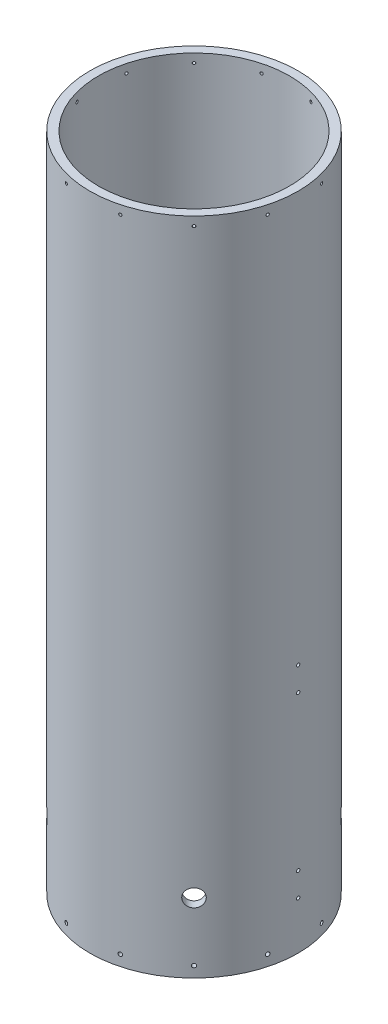
from build123d import *

# Parameters (mm, degrees)
SKETCH1_R                         = 152.4
SKETCH1_R_2                       = 139.7
BOSS_EXTRUDE1_DEPTH               = 965.2
F_10_0_1935_DIAMETER_HOLE2_REACH  = 1025.592
F_10_0_1935_DIAMETER_HOLE2_BORE_R = 2.45745
CIRPATTERN2_COUNT                 = 2
TAP_DRILL_FOR_10_32_TAP1_REACH    = 1034.948
TAP_DRILL_FOR_10_32_TAP1_BORE_R   = 2.0193
CIRPATTERN3_COUNT                 = 12
CUT_EXTRUDE1_REACH                = 1034.948
CUT_EXTRUDE1_END_RADIUS           = 139.7
SKETCH12_R                        = 12.7
CIRPATTERN4_COUNT                 = 4
CUT_EXTRUDE2_REACH                = 1025.592
CUT_EXTRUDE2_END_RADIUS           = 139.7
SKETCH13_R                        = 12.7
F_10_CLEARANCE_HOLE2_REACH        = 1034.948
F_10_CLEARANCE_HOLE2_BORE_R       = 2.8067
CIRPATTERN5_COUNT                 = 12


with BuildPart() as part:
    # Sketch1 → Boss-Extrude1 (new body)
    with BuildSketch(Plane(origin=(0, 0, 0), x_dir=(1, 0, 0), z_dir=(0, 1, 0))):
        with Locations(Location((0, 0, 0), (0, 0, 90))):
            Circle(SKETCH1_R)
        with Locations(Location((0, 0, 0), (0, 0, 90))):
            Circle(SKETCH1_R_2, mode=Mode.SUBTRACT)
    extrude(amount=BOSS_EXTRUDE1_DEPTH)

    # #10 (0.1935) Diameter Hole2 bore → #10 (0.1935) Diameter Hole2 (cut, up to next)
    with BuildSketch(Plane.ZY.offset(152.4), mode=Mode.PRIVATE) as f_10_0_1935_diameter_hole2_sk1:
        with Locations((0, 365.125)):
            Circle(F_10_0_1935_DIAMETER_HOLE2_BORE_R)
    f_10_0_1935_diameter_hole2_tool1 = extrude(f_10_0_1935_diameter_hole2_sk1.sketch, amount=-F_10_0_1935_DIAMETER_HOLE2_REACH, mode=Mode.PRIVATE) & part.part
    # #10 (0.1935) Diameter Hole2 bore → #10 (0.1935) Diameter Hole2 (cut, up to next)
    with BuildSketch(Plane.ZY.offset(152.4), mode=Mode.PRIVATE) as f_10_0_1935_diameter_hole2_sk2:
        with Locations((0, 330.2)):
            Circle(F_10_0_1935_DIAMETER_HOLE2_BORE_R)
    f_10_0_1935_diameter_hole2_tool2 = extrude(f_10_0_1935_diameter_hole2_sk2.sketch, amount=-F_10_0_1935_DIAMETER_HOLE2_REACH, mode=Mode.PRIVATE) & part.part
    # #10 (0.1935) Diameter Hole2 bore → #10 (0.1935) Diameter Hole2 (cut, up to next)
    with BuildSketch(Plane.ZY.offset(152.4), mode=Mode.PRIVATE) as f_10_0_1935_diameter_hole2_sk3:
        with Locations((0, 104.775)):
            Circle(F_10_0_1935_DIAMETER_HOLE2_BORE_R)
    f_10_0_1935_diameter_hole2_tool3 = extrude(f_10_0_1935_diameter_hole2_sk3.sketch, amount=-F_10_0_1935_DIAMETER_HOLE2_REACH, mode=Mode.PRIVATE) & part.part
    # #10 (0.1935) Diameter Hole2 bore → #10 (0.1935) Diameter Hole2 (cut, up to next)
    with BuildSketch(Plane.ZY.offset(152.4), mode=Mode.PRIVATE) as f_10_0_1935_diameter_hole2_sk4:
        with Locations((0, 69.85)):
            Circle(F_10_0_1935_DIAMETER_HOLE2_BORE_R)
    f_10_0_1935_diameter_hole2_tool4 = extrude(f_10_0_1935_diameter_hole2_sk4.sketch, amount=-F_10_0_1935_DIAMETER_HOLE2_REACH, mode=Mode.PRIVATE) & part.part
    f_10_0_1935_diameter_hole2_1 = f_10_0_1935_diameter_hole2_tool1.solids().sort_by_distance((-152.4, 365.125, 0))[0]
    add(f_10_0_1935_diameter_hole2_1, mode=Mode.SUBTRACT)
    f_10_0_1935_diameter_hole2_2 = f_10_0_1935_diameter_hole2_tool2.solids().sort_by_distance((-152.4, 330.2, 0))[0]
    add(f_10_0_1935_diameter_hole2_2, mode=Mode.SUBTRACT)
    f_10_0_1935_diameter_hole2_3 = f_10_0_1935_diameter_hole2_tool3.solids().sort_by_distance((-152.4, 104.775, 0))[0]
    add(f_10_0_1935_diameter_hole2_3, mode=Mode.SUBTRACT)
    f_10_0_1935_diameter_hole2_4 = f_10_0_1935_diameter_hole2_tool4.solids().sort_by_distance((-152.4, 69.85, 0))[0]
    add(f_10_0_1935_diameter_hole2_4, mode=Mode.SUBTRACT)
    f_10_0_1935_diameter_hole2 = f_10_0_1935_diameter_hole2_1 + f_10_0_1935_diameter_hole2_2 + f_10_0_1935_diameter_hole2_3 + f_10_0_1935_diameter_hole2_4  # #10 (0.1935) Diameter Hole2 as one shape, for the pattern or mirror that repeats it

    # CirPattern2: #10 (0.1935) Diameter Hole2 ×2 about axis
    cirpattern2_axis = Axis((0, 965.2, 0), (0, 1, 0))
    for i in range(1, CIRPATTERN2_COUNT):
        add(f_10_0_1935_diameter_hole2.rotate(cirpattern2_axis, i * 360 / CIRPATTERN2_COUNT), mode=Mode.SUBTRACT)

    # Tap Drill for #10-32 Tap1 bore → Tap Drill for #10-32 Tap1 (cut, up to next)
    with BuildSketch(Plane(origin=(-107.763073453, 0, -107.763073453), x_dir=(0, -1, 0), z_dir=(-0.7071067811865464, 0, -0.7071067811865488)), mode=Mode.PRIVATE) as tap_drill_for_10_32_tap1_sk1:
        with Locations((-952.5, 0)):
            Circle(TAP_DRILL_FOR_10_32_TAP1_BORE_R)
    tap_drill_for_10_32_tap1_tool1 = extrude(tap_drill_for_10_32_tap1_sk1.sketch, amount=-TAP_DRILL_FOR_10_32_TAP1_REACH, mode=Mode.PRIVATE) & part.part
    tap_drill_for_10_32_tap1 = tap_drill_for_10_32_tap1_tool1.solids().sort_by_distance((-107.763073, 952.5, -107.763073))[0]
    add(tap_drill_for_10_32_tap1, mode=Mode.SUBTRACT)

    # CirPattern3: Tap Drill for #10-32 Tap1 ×12 about axis
    cirpattern3_axis = Axis((0, 965.2, 0), (0, -1, 0))
    for i in range(1, CIRPATTERN3_COUNT):
        add(tap_drill_for_10_32_tap1.rotate(cirpattern3_axis, i * 360 / CIRPATTERN3_COUNT), mode=Mode.SUBTRACT)

    # Cut-Extrude1: up to this cylinder (the profile starts outside it)
    cut_extrude1_end = Plane(origin=(0, 101.6, 0), z_dir=(0, -1, 0)) * Cylinder(CUT_EXTRUDE1_END_RADIUS, 2350.296, mode=Mode.PRIVATE)
    # Sketch12 → Cut-Extrude1 (cut, up to the surface)
    with BuildSketch(Plane(origin=(-107.763073453, 0, -107.763073453), x_dir=(0, -1, 0), z_dir=(-0.7071067811865464, 0, -0.7071067811865488)), mode=Mode.PRIVATE) as cut_extrude1_sk1:
        with Locations(Location((-101.6, 0, 0), (0, 0, 90))):
            Circle(SKETCH12_R)
    cut_extrude1_tool1 = extrude(cut_extrude1_sk1.sketch, amount=-CUT_EXTRUDE1_REACH, mode=Mode.PRIVATE) - cut_extrude1_end
    cut_extrude1 = cut_extrude1_tool1.solids().sort_by_distance((-107.763073, 101.6, -107.763073))[0]
    add(cut_extrude1, mode=Mode.SUBTRACT)

    # CirPattern4: Cut-Extrude1 ×4 about axis
    cirpattern4_axis = Axis((0, 965.2, 0), (0, -1, 0))
    for i in range(1, CIRPATTERN4_COUNT):
        add(cut_extrude1.rotate(cirpattern4_axis, i * 360 / CIRPATTERN4_COUNT), mode=Mode.SUBTRACT)

    # Cut-Extrude2: up to this cylinder (the profile starts outside it)
    cut_extrude2_end = Plane(origin=(0, 228.6, 0), z_dir=(0, -1, 0)) * Cylinder(CUT_EXTRUDE2_END_RADIUS, 2331.584, mode=Mode.PRIVATE)
    # Sketch13 → Cut-Extrude2 (cut, up to the surface)
    with BuildSketch(Plane(origin=(0, 0, -152.4), x_dir=(0, -1, 0), z_dir=(0, 0, -1)), mode=Mode.PRIVATE) as cut_extrude2_sk1:
        with Locations(Location((-228.6, 0, 0), (0, 0, 90))):
            Circle(SKETCH13_R)
    cut_extrude2_tool1 = extrude(cut_extrude2_sk1.sketch, amount=-CUT_EXTRUDE2_REACH, mode=Mode.PRIVATE) - cut_extrude2_end
    add(cut_extrude2_tool1.solids().sort_by_distance((0, 228.6, -152.4))[0], mode=Mode.SUBTRACT)

    # #10 Clearance Hole2 bore → #10 Clearance Hole2 (cut, up to next)
    with BuildSketch(Plane(origin=(-107.763073453, 0, -107.763073453), x_dir=(0, -1, 0), z_dir=(-0.7071067811865464, 0, -0.7071067811865488)), mode=Mode.PRIVATE) as f_10_clearance_hole2_sk1:
        with Locations((-15.875, 0)):
            Circle(F_10_CLEARANCE_HOLE2_BORE_R)
    f_10_clearance_hole2_tool1 = extrude(f_10_clearance_hole2_sk1.sketch, amount=-F_10_CLEARANCE_HOLE2_REACH, mode=Mode.PRIVATE) & part.part
    f_10_clearance_hole2 = f_10_clearance_hole2_tool1.solids().sort_by_distance((-107.763073, 15.875, -107.763073))[0]
    add(f_10_clearance_hole2, mode=Mode.SUBTRACT)

    # CirPattern5: #10 Clearance Hole2 ×12 about axis
    cirpattern5_axis = Axis((0, 965.2, 0), (0, -1, 0))
    for i in range(1, CIRPATTERN5_COUNT):
        add(f_10_clearance_hole2.rotate(cirpattern5_axis, i * 360 / CIRPATTERN5_COUNT), mode=Mode.SUBTRACT)


solid = part.part
